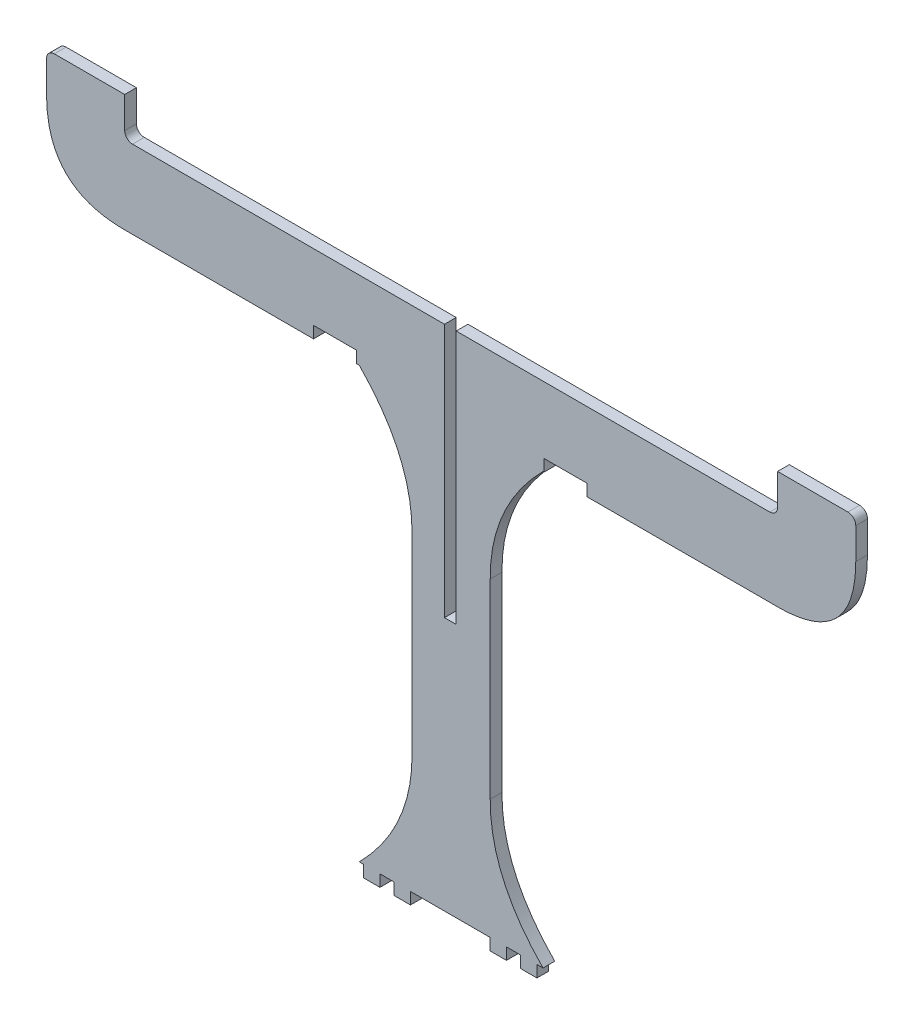
from build123d import *

# Parameters (mm, degrees)
P_IDAT_VYSUNUT_M2_DEPTH  = 3
SKICA2_W                 = 3
SKICA2_H                 = 65
ODEBRAT_VYSUNUT_M3_DEPTH = 3
SKICA3_W                 = 11
SKICA3_H                 = 5.694256757
ODEBRAT_VYSUNUT_M4_DEPTH = 3


with BuildPart() as part:
    # Skica1 → Přidat vysunutím2 (new body)
    with BuildSketch(Plane.XY):
        with BuildLine():
            Line((-90.642636358, 2.694256757), (-30.642636358, 2.694256757))
            add(Edge.make_bspline(
                [(-30.642636358, 2.694256757), (-17.025139471, -11.118063286), (-17.142636358, -27.878389443)],
                knots=[0, 0, 0, 1, 1, 1], degree=2))
            Line((-17.142636358, -27.878389443), (-17.142636358, -76.655981804))
            add(Edge.make_bspline(
                [(-30.642636358, -107.305743243), (-17.009316786, -93.458261678), (-17.142636358, -76.655981804)],
                knots=[0, 0, 0, 1, 1, 1], degree=2))
            Line((-30.642636358, -107.305743243), (-29.497972973, -107.305743243))
            Line((-29.497972973, -107.305743243), (-29.497972973, -110.305743243))
            Line((-29.497972973, -110.305743243), (-25.347972973, -110.305743243))
            Line((-25.347972973, -110.305743243), (-25.347972973, -107.305743243))
            Line((-25.347972973, -107.305743243), (-21.697972973, -107.305743243))
            Line((-21.697972973, -107.305743243), (-21.697972973, -110.305743243))
            Line((-21.697972973, -110.305743243), (-17.547972973, -110.305743243))
            Line((-17.547972973, -110.305743243), (-17.547972973, -107.305743243))
            Line((-17.547972973, -107.305743243), (2.852027027, -107.305743243))
            Line((2.852027027, -107.305743243), (2.852027027, -110.305743243))
            Line((2.852027027, -110.305743243), (7.002027027, -110.305743243))
            Line((7.002027027, -110.305743243), (7.002027027, -107.305743243))
            Line((7.002027027, -107.305743243), (10.652027027, -107.305743243))
            Line((10.652027027, -107.305743243), (10.652027027, -110.305743243))
            Line((10.652027027, -110.305743243), (14.802027027, -110.305743243))
            Line((14.802027027, -110.305743243), (14.802027027, -107.305743243))
            Line((14.802027027, -107.305743243), (16.357363642, -107.305743243))
            add(Edge.make_bspline(
                [(16.357363642, -107.305743243), (2.72404407, -93.458261678), (2.857363642, -76.655981804)],
                knots=[0, 0, 0, 1, 1, 1], degree=2))
            Line((2.857363642, -76.655981804), (2.857363642, -27.878389443))
            add(Edge.make_bspline(
                [(16.357363642, 2.694256757), (2.739866756, -11.118063286), (2.857363642, -27.878389443)],
                knots=[0, 0, 0, 1, 1, 1], degree=2))
            Line((16.357363642, 2.694256757), (76.357363642, 2.694256757))
            add(Edge.make_bspline(
                [(96.357363642, 22.694256757), (96.357363642, 2.694256757), (76.357363642, 2.694256757)],
                knots=[0, 0, 0, 1, 1, 1], degree=2))
            Line((96.357363642, 22.694256757), (96.357363642, 30.694256757))
            ThreePointArc((96.357363642, 30.694256757), (95.771577204, 32.108470319), (94.357363642, 32.694256757))
            Line((94.357363642, 32.694256757), (76.357363642, 32.694256757))
            Line((76.357363642, 32.694256757), (76.357363642, 24.694256757))
            ThreePointArc((76.357363642, 24.694256757), (75.771577204, 23.280043194), (74.357363642, 22.694256757))
            Line((74.357363642, 22.694256757), (-88.642636358, 22.694256757))
            ThreePointArc((-88.642636358, 22.694256757), (-90.05684992, 23.280043194), (-90.642636358, 24.694256757))
            Line((-90.642636358, 24.694256757), (-90.642636358, 32.694256757))
            Line((-90.642636358, 32.694256757), (-108.642636358, 32.694256757))
            ThreePointArc((-108.642636358, 32.694256757), (-110.05684992, 32.108470319), (-110.642636358, 30.694256757))
            Line((-110.642636358, 30.694256757), (-110.642636358, 22.694256757))
            add(Edge.make_bspline(
                [(-110.642636358, 22.694256757), (-110.642636358, 2.694256757), (-90.642636358, 2.694256757)],
                knots=[0, 0, 0, 1, 1, 1], degree=2))
        make_face()
    extrude(amount=P_IDAT_VYSUNUT_M2_DEPTH)

    # Skica2 → Odebrat vysunutím3 (cut)
    with BuildSketch(Plane(origin=(0, 0, 0), x_dir=(-1, 0, 0), z_dir=(0, 0, -1))):
        with Locations((7.347972973, -9.805743243)):
            Rectangle(SKICA2_W, SKICA2_H)
    extrude(amount=-ODEBRAT_VYSUNUT_M3_DEPTH, mode=Mode.SUBTRACT)

    # Skica3 → Odebrat vysunutím4 (cut)
    with BuildSketch(Plane(origin=(0, 0, 0), x_dir=(-1, 0, 0), z_dir=(0, 0, -1))):
        with Locations((-22.152027027, 2.847128379)):
            Rectangle(SKICA3_W, SKICA3_H)
        with Locations((36.847972973, 2.847128379)):
            Rectangle(SKICA3_W, SKICA3_H)
    extrude(amount=-ODEBRAT_VYSUNUT_M4_DEPTH, mode=Mode.SUBTRACT)


solid = part.part
